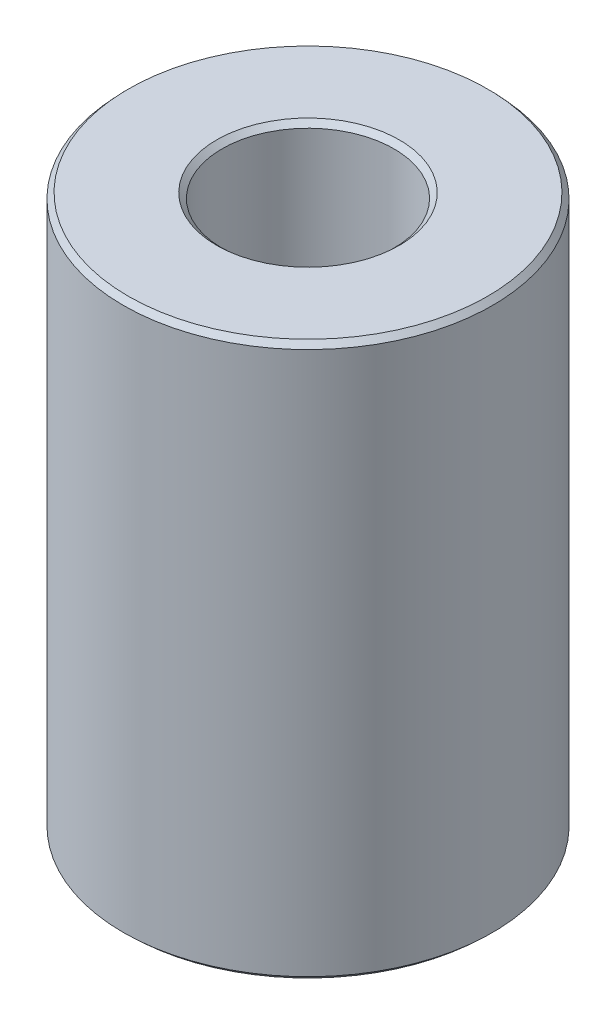
from build123d import *
from OCP.BRepFilletAPI import BRepFilletAPI_MakeChamfer

# Parameters (mm, degrees)
SKETCH1_R           = 47.5
BOSS_EXTRUDE1_DEPTH = 142.421724711
SKETCH2_R           = 22.128384908
CUT_EXTRUDE1_DEPTH  = 158.468878416
CHAMFER1_SIZE       = 1.393530645
CHAMFER1_SIZE2      = 1.29029531


with BuildPart() as part:
    # Sketch1 → Boss-Extrude1 (new body)
    with BuildSketch(Plane(origin=(0, 0, 0), x_dir=(1, 0, 0), z_dir=(0, 1, 0))):
        Circle(SKETCH1_R)
    extrude(amount=BOSS_EXTRUDE1_DEPTH)

    # Sketch2 → Cut-Extrude1 (cut, through all)
    with BuildSketch(Plane(origin=(0, 0, 0), x_dir=(1, 0, 0), z_dir=(0, 1, 0))):
        Circle(SKETCH2_R)
    extrude(amount=CUT_EXTRUDE1_DEPTH, mode=Mode.SUBTRACT)

    # Chamfer1: one chamfer whose edges measure the first distance from different faces: ONE call of the kernel's chamfer builder (chamfer() names one face for all edges)
    chamfer1_edges_1 = [part.edges().sort_by_distance(p)[0] for p in [
        (-22.128384908, 142.421724711, 0),
    ]]
    chamfer1_side_1 = [part.faces().sort_by_distance(p)[0] for p in [
        (-46.156497116, 142.421724711, 0),
    ]]
    chamfer1_edges_2 = [part.edges().sort_by_distance(p)[0] for p in [
        (-22.128384908, 0, 0),
    ]]
    chamfer1_side_2 = [part.faces().sort_by_distance(p)[0] for p in [
        (-22.128384908, 71.210862355, 0),
    ]]
    chamfer1_edges_3 = [part.edges().sort_by_distance(p)[0] for p in [
        (-47.5, 0, 0),
    ]]
    chamfer1_side_3 = [part.faces().sort_by_distance(p)[0] for p in [
        (-46.156497116, 0, 0),
    ]]
    chamfer1_edges_4 = [part.edges().sort_by_distance(p)[0] for p in [
        (-47.5, 142.421724711, 0),
    ]]
    chamfer1_side_4 = [part.faces().sort_by_distance(p)[0] for p in [
        (-47.5, 71.210862355, 0),
    ]]
    chamfer1 = BRepFilletAPI_MakeChamfer(part.part.solid().wrapped)
    for e in chamfer1_edges_1:
        chamfer1.Add(CHAMFER1_SIZE, CHAMFER1_SIZE2, e.wrapped, chamfer1_side_1[0].wrapped)  # the first distance lies on this face
    for e in chamfer1_edges_2:
        chamfer1.Add(CHAMFER1_SIZE, CHAMFER1_SIZE2, e.wrapped, chamfer1_side_2[0].wrapped)  # the first distance lies on this face
    for e in chamfer1_edges_3:
        chamfer1.Add(CHAMFER1_SIZE, CHAMFER1_SIZE2, e.wrapped, chamfer1_side_3[0].wrapped)  # the first distance lies on this face
    for e in chamfer1_edges_4:
        chamfer1.Add(CHAMFER1_SIZE, CHAMFER1_SIZE2, e.wrapped, chamfer1_side_4[0].wrapped)  # the first distance lies on this face
    add(Compound.cast(chamfer1.Shape()), mode=Mode.REPLACE)


solid = part.part
